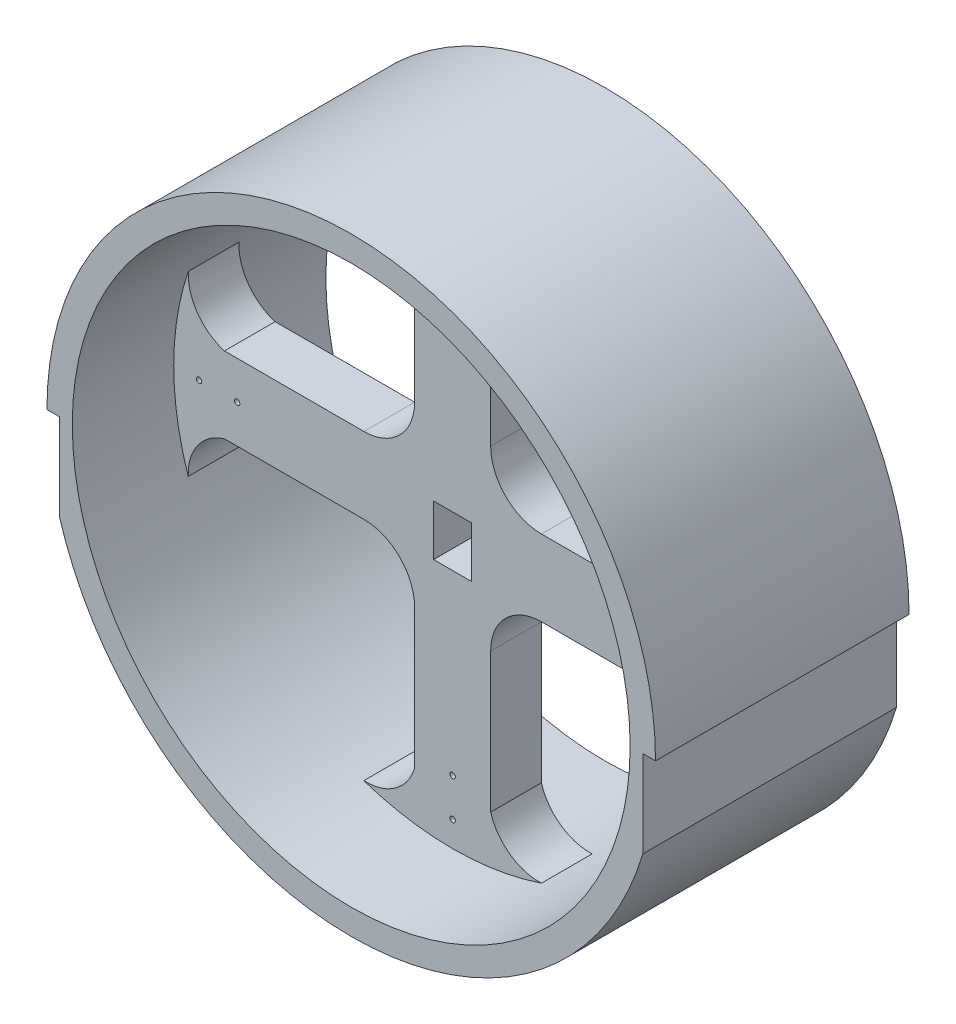
from build123d import *

# Parameters (mm, degrees)
SKETCH1_R               = 152.4
SKETCH1_R_2             = 139.7
BOSS_EXTRUDE1_DEPTH     = 63.5
BOSS_EXTRUDE2_DEPTH     = 12.7
CUT_EXTRUDE3_DEPTH      = 225.685936365
CUT_EXTRUDE3_DEPTH_BACK = 225.685936365
SKETCH4_W               = 19.05
SKETCH4_H               = 19.05
SKETCH7_W               = 19.05
SKETCH7_H               = 6.35
CUT_EXTRUDE4_DEPTH      = 229.6
SKETCH8_W               = 17.202693119
SKETCH8_H               = 50.8
CUT_EXTRUDE5_DEPTH      = 251.160988166
F_4_40_TAPPED_HOLE1_D   = 2.2606
F_6_32_TAPPED_HOLE1_D   = 2.7051
CIRPATTERN1_COUNT       = 4


with BuildPart() as part:
    # Sketch1 → Boss-Extrude1 (new, symmetric)
    with BuildSketch(Plane.XY):
        Circle(SKETCH1_R)
        Circle(SKETCH1_R_2, mode=Mode.SUBTRACT)
    extrude(amount=BOSS_EXTRUDE1_DEPTH, both=True)

    # Sketch2 → Boss-Extrude2 (add, symmetric)
    with BuildSketch(Plane.XY):
        with BuildLine():
            Line((-44.45, 19.05), (-114.3, 19.05))
            ThreePointArc((-114.3, 19.05), (-127.736482233, 28.655491493), (-132.425396447, 44.492745205))
            Line((-132.425396447, 44.492745205), (-143.350279695, 19.05))
            Line((-143.350279695, 19.05), (-147.191797275, 19.05))
            Line((-147.191797275, 19.05), (-147.191797275, -19.05))
            Line((-147.191797275, -19.05), (-143.95681272, -19.05))
            Line((-143.95681272, -19.05), (-132.439750453, -44.45))
            ThreePointArc((-132.439750453, -44.45), (-127.731621931, -28.635000127), (-114.3, -19.05))
            Line((-114.3, -19.05), (-44.45, -19.05))
            ThreePointArc((-44.45, -19.05), (-26.489487758, -26.489487758), (-19.05, -44.45))
            Line((-19.05, -44.45), (-19.05, -114.3))
            ThreePointArc((-19.05, -114.3), (-28.655491493, -127.736482233), (-44.492745205, -132.425396447))
            Line((-44.492745205, -132.425396447), (-19.05, -143.350279695))
            Line((-19.05, -143.350279695), (-19.05, -143.95681272))
            Line((-19.05, -143.95681272), (19.05, -143.95681272))
            Line((19.05, -143.95681272), (44.45, -132.439750453))
            ThreePointArc((44.45, -132.439750453), (28.635000127, -127.731621931), (19.05, -114.3))
            Line((19.05, -114.3), (19.05, -44.45))
            ThreePointArc((19.05, -44.45), (26.489487758, -26.489487758), (44.45, -19.05))
            Line((44.45, -19.05), (114.3, -19.05))
            ThreePointArc((114.3, -19.05), (127.736482233, -28.655491493), (132.425396447, -44.492745205))
            Line((132.425396447, -44.492745205), (143.350279695, -19.05))
            Line((143.350279695, -19.05), (147.191797275, -19.05))
            Line((147.191797275, -19.05), (147.191797275, 19.05))
            Line((147.191797275, 19.05), (143.95681272, 19.05))
            Line((143.95681272, 19.05), (132.439750453, 44.45))
            ThreePointArc((132.439750453, 44.45), (127.731621931, 28.635000127), (114.3, 19.05))
            Line((114.3, 19.05), (44.45, 19.05))
            ThreePointArc((44.45, 19.05), (26.489487758, 26.489487758), (19.05, 44.45))
            Line((19.05, 44.45), (19.05, 114.3))
            ThreePointArc((19.05, 114.3), (28.655491493, 127.736482233), (44.492745205, 132.425396447))
            Line((44.492745205, 132.425396447), (19.05, 143.350279695))
            Line((19.05, 143.350279695), (19.05, 143.95681272))
            Line((19.05, 143.95681272), (-19.05, 143.95681272))
            Line((-19.05, 143.95681272), (-44.45, 132.439750453))
            ThreePointArc((-44.45, 132.439750453), (-28.635000127, 127.731621931), (-19.05, 114.3))
            Line((-19.05, 114.3), (-19.05, 44.45))
            ThreePointArc((-19.05, 44.45), (-26.489487758, 26.489487758), (-44.45, 19.05))
        make_face()
    extrude(amount=BOSS_EXTRUDE2_DEPTH, both=True)

    # Sketch4 → Cut-Extrude3 (cut, two sides: drawn at the far end of the back side and taken through both)
    with BuildSketch(Plane.XY.offset(-CUT_EXTRUDE3_DEPTH_BACK)):
        with Locations((0, -9.525)):
            Rectangle(SKETCH4_W, SKETCH4_H)
    extrude(amount=CUT_EXTRUDE3_DEPTH + CUT_EXTRUDE3_DEPTH_BACK, mode=Mode.SUBTRACT)

    # Sketch7 → Cut-Extrude4 (cut, through all)
    with BuildSketch(Plane.XY.offset(12.7)):
        with Locations((0, 3.175)):
            Rectangle(SKETCH7_W, SKETCH7_H)
    extrude(amount=-CUT_EXTRUDE4_DEPTH, mode=Mode.SUBTRACT)

    # Sketch8 → Cut-Extrude5 (cut, through all)
    with BuildSketch(Plane.XY.offset(63.5)):
        with Locations((-154.65134656, -25.4)):
            Rectangle(SKETCH8_W, SKETCH8_H)
    cut_extrude5 = extrude(amount=-CUT_EXTRUDE5_DEPTH, mode=Mode.SUBTRACT)

    # Mirror1: Cut-Extrude5 across plane
    add(cut_extrude5.mirror(Plane(origin=(0, 0, 0), x_dir=(0, 0, 1), z_dir=(1, 0, 0))), mode=Mode.SUBTRACT)

    # #4-40 Tapped Hole1 (through all)
    with Locations(Plane.XY.offset(12.7)):
        with Locations((-14.2875, 88.9), (-6.0325, 88.9), (88.9, 14.2875), (88.9, 6.0325)):
            Hole(F_4_40_TAPPED_HOLE1_D / 2)

    # #6-32 Tapped Hole1 (through all)
    with Locations(Plane.XY.offset(12.7)):
        with Locations((-107.95, 0), (-127, 0)):
            f_6_32_tapped_hole1 = Hole(F_6_32_TAPPED_HOLE1_D / 2)

    # CirPattern1: #6-32 Tapped Hole1 ×4 about axis
    cirpattern1_axis = Axis((0, 0, 63.5), (0, 0, 1))
    for i in range(1, CIRPATTERN1_COUNT):
        add(f_6_32_tapped_hole1.rotate(cirpattern1_axis, i * 360 / CIRPATTERN1_COUNT), mode=Mode.SUBTRACT)


solid = part.part
